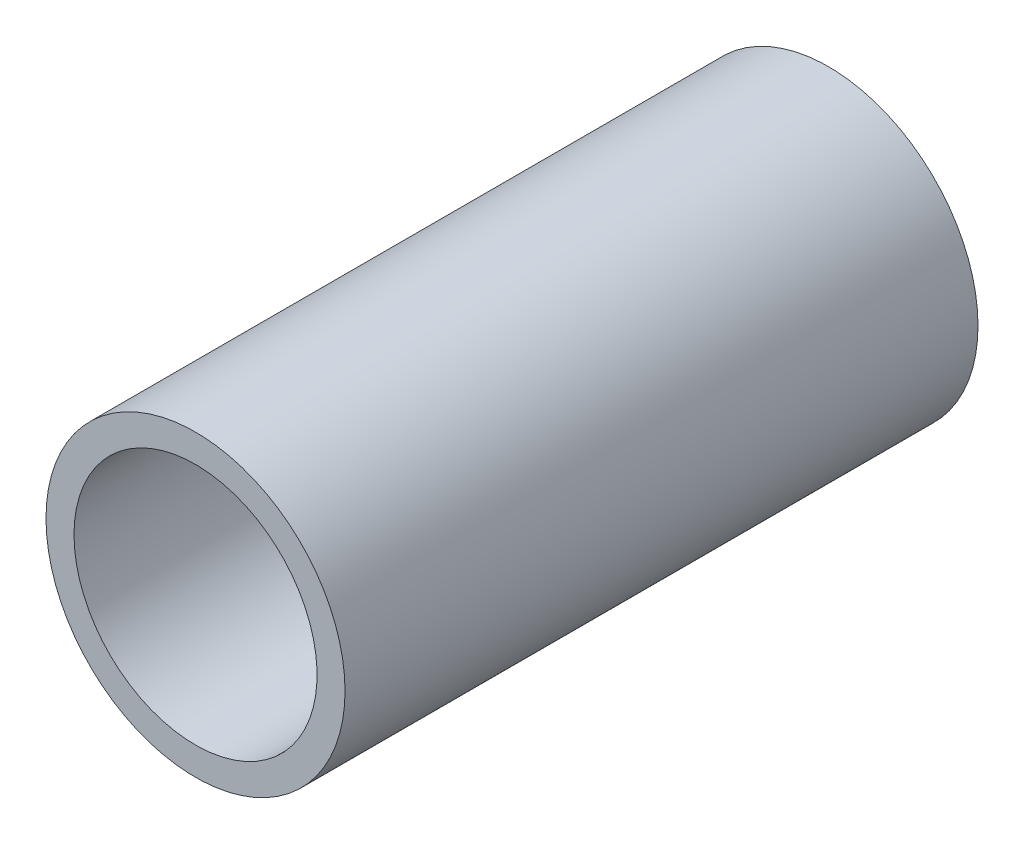
from build123d import *

# Parameters (mm, degrees)
SKETCH1_R             = 1.5
BOSS_EXTRUDE1_DEPTH   = 6.35
F_2_CLEARANCE_HOLE2_D = 2.4384


with BuildPart() as part:
    # Sketch1 → Boss-Extrude1 (new body)
    with BuildSketch(Plane.XY):
        Circle(SKETCH1_R)
    extrude(amount=BOSS_EXTRUDE1_DEPTH)

    # #2 Clearance Hole2 (through all)
    with Locations(Plane(origin=(0, 0, 0), x_dir=(-1, 0, 0), z_dir=(0, 0, -1))):
        with Locations((0, 0)):
            Hole(F_2_CLEARANCE_HOLE2_D / 2)


solid = part.part
